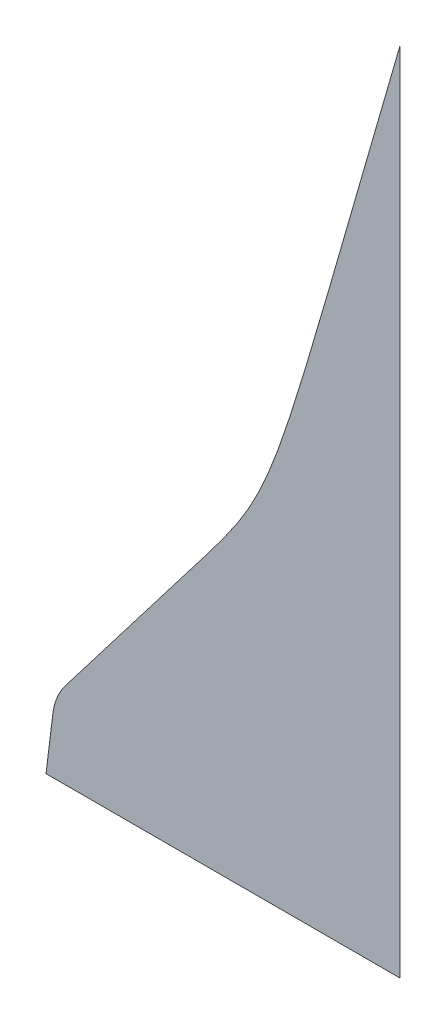
from build123d import *

# Parameters (mm, degrees)
BOSS_EXTRUDE1_DEPTH = 0.127


with BuildPart() as part:
    # Sketch1 → Boss-Extrude1 (new body)
    with BuildSketch(Plane.XY):
        with BuildLine():
            Line((0, 1651), (0, 0))
            Line((0, 0), (-723.9, 0))
            Line((-723.9, 0), (-709.936002969, 113.443804533))
            ThreePointArc((-709.936002969, 113.443804533), (-701.431945145, 146.014255937), (-684.669714613, 175.206394121))
            Line((-684.669714613, 175.206394121), (-443.570057255, 489.636807597))
            add(Edge.make_bspline(
                [(-443.570057255, 489.636807597), (-241.660374178, 752.957568109), (-282.743051657, 676.944413423), (0, 1651)],
                knots=[0, 0, 0, 0, 1, 1, 1, 1], degree=3))
        make_face()
    extrude(amount=BOSS_EXTRUDE1_DEPTH)


solid = part.part
